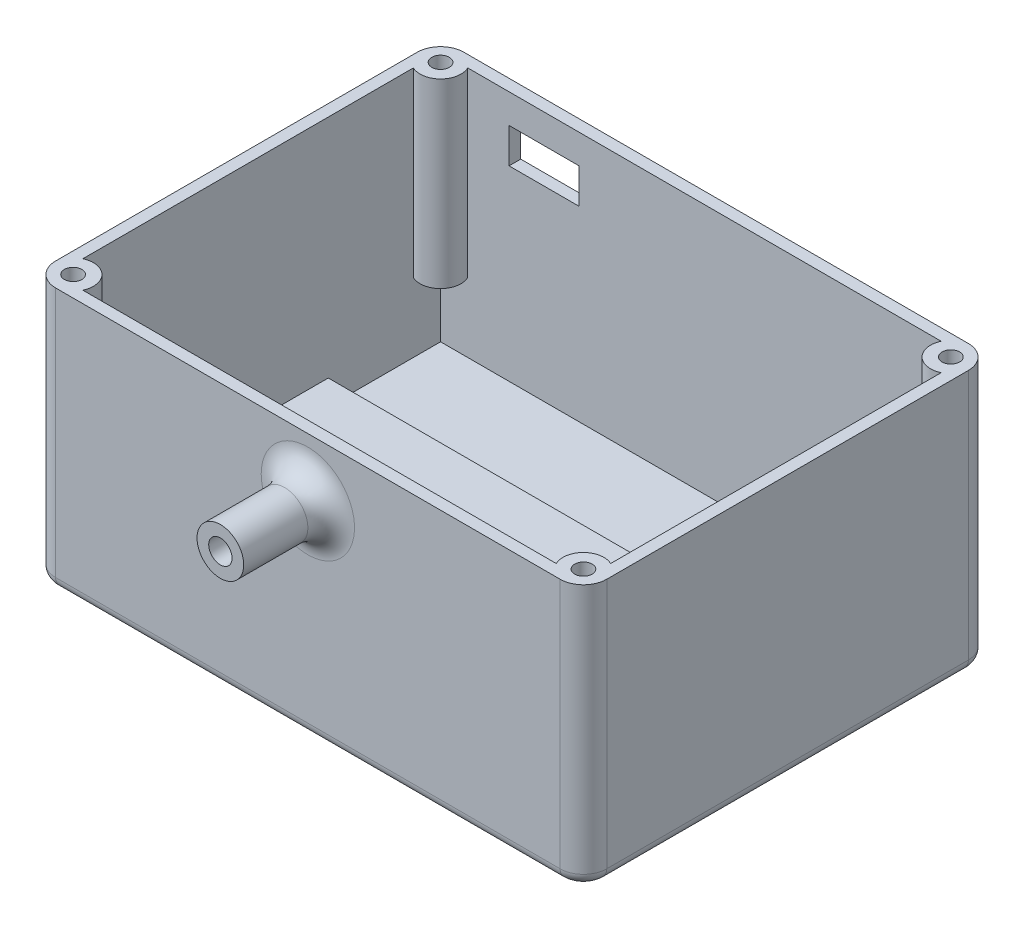
from build123d import *

# Parameters (mm, degrees)
SKETCH1_W                 = 94.5
SKETCH1_H                 = 70
BOSS_EXTRUDE1_DEPTH       = 45
F_3_0MM_DOWEL_HOLE1_D     = 3
F_3_0MM_DOWEL_HOLE1_DEPTH = 30
F_3_0MM_DOWEL_HOLE1_TIP   = 0.901290929
SKETCH7_W                 = 55
SKETCH7_H                 = 28
CUT_EXTRUDE2_DEPTH        = 20
SHELL2_START              = 2
SHELL2_DEPTH              = 43
SHELL2_START_2            = 22
SHELL2_2_OUTLINE_W        = 59
SHELL2_2_OUTLINE_H        = 31
SHELL2_2_DEPTH            = 23
SHELL2_3_DEPTH            = 11.868454444
CUT_EXTRUDE3_DEPTH        = 1.5
BOSS_EXTRUDE9_DEPTH       = 11
F_3_0MM_DOWEL_HOLE3_D     = 3
F_3_0MM_DOWEL_HOLE3_DEPTH = 10
F_3_0MM_DOWEL_HOLE3_TIP   = 0.901290929
SKETCH15_R                = 3.5
CUT_EXTRUDE4_DEPTH        = 3
SKETCH30_W                = 10.076322372
SKETCH30_H                = 8
BOSS_EXTRUDE5_DEPTH       = 20
SKETCH31_W                = 15
SKETCH31_H                = 10.554348819
BOSS_EXTRUDE6_DEPTH       = 20
F_3_0MM_DOWEL_HOLE4_D     = 3
F_3_0MM_DOWEL_HOLE4_DEPTH = 41
F_3_0MM_DOWEL_HOLE4_TIP   = 0.901290929
SKETCH27_W                = 12
SKETCH27_H                = 6
CUT_EXTRUDE5_DEPTH        = 30
SKETCH33_R                = 4
BOSS_EXTRUDE7_DEPTH       = 15
SKETCH34_R                = 2
CUT_EXTRUDE6_DEPTH        = 30
FILLET1_R                 = 4
FILLET2_R                 = 4
FILLET3_R                 = 2


with BuildPart() as part:
    # Sketch1 → Boss-Extrude1 (new body)
    with BuildSketch(Plane(origin=(0, 0, 0), x_dir=(1, 0, 0), z_dir=(0, 1, 0))):
        Rectangle(SKETCH1_W, SKETCH1_H)
    extrude(amount=BOSS_EXTRUDE1_DEPTH)

    # Ø3.0mm Dowel Hole1
    with Locations(Plane(origin=(-43.75, 45, -31.5), x_dir=(0, 0, 1), z_dir=(0, 1, 0))):
        with Locations((0, 0), (0, 87.5), (63, 87.5), (63, 0)):
            Hole(F_3_0MM_DOWEL_HOLE1_D / 2, depth=F_3_0MM_DOWEL_HOLE1_DEPTH)
            with Locations((0, 0, -(F_3_0MM_DOWEL_HOLE1_DEPTH + F_3_0MM_DOWEL_HOLE1_TIP / 2))):  # 118° drill point
                Cone(0, F_3_0MM_DOWEL_HOLE1_D / 2, F_3_0MM_DOWEL_HOLE1_TIP, mode=Mode.SUBTRACT)

    # Sketch7 → Cut-Extrude2 (cut)
    with BuildSketch(Plane.XZ):
        with Locations((0, 18)):
            Rectangle(SKETCH7_W, SKETCH7_H)
    extrude(amount=-CUT_EXTRUDE2_DEPTH, mode=Mode.SUBTRACT)

    # Shell2: read off the stored shape, not the designer's step
    # Shell2 outline → Shell2 (cut)
    with BuildSketch(Plane(origin=(0, 0, 0), x_dir=(1, 0, 0), z_dir=(0, 1, 0)).offset(SHELL2_START)):
        with BuildLine():
            Line((-45.25, 28.33772234), (-45.25, -28.33772234))
            ThreePointArc((-45.25, -28.33772234), (-41.275126266, -29.025126266), (-40.58772234, -33))
            Line((-40.58772234, -33), (-29.5, -33))
            Line((-29.5, -33), (-29.5, -2))
            Line((-29.5, -2), (29.5, -2))
            Line((29.5, -2), (29.5, -33))
            Line((29.5, -33), (40.58772234, -33))
            ThreePointArc((40.58772234, -33), (41.275126266, -29.025126266), (45.25, -28.33772234))
            Line((45.25, -28.33772234), (45.25, 28.33772234))
            ThreePointArc((45.25, 28.33772234), (41.275126266, 29.025126266), (40.58772234, 33))
            Line((40.58772234, 33), (-40.58772234, 33))
            ThreePointArc((-40.58772234, 33), (-41.275126266, 29.025126266), (-45.25, 28.33772234))
        make_face()
    extrude(amount=SHELL2_DEPTH, mode=Mode.SUBTRACT)

    # Shell2 2 outline → Shell2 2 (cut)
    with BuildSketch(Plane(origin=(0, 0, 0), x_dir=(1, 0, 0), z_dir=(0, 1, 0)).offset(SHELL2_START_2)):
        with Locations((0, -17.5)):
            Rectangle(SHELL2_2_OUTLINE_W, SHELL2_2_OUTLINE_H)
    extrude(amount=SHELL2_2_DEPTH, mode=Mode.SUBTRACT)

    # Shell2 3 outline → Shell2 3 (cut)
    with BuildSketch(Plane(origin=(0, 0, 0), x_dir=(1, 0, 0), z_dir=(0, 1, 0)).offset(SHELL2_START)):
        with BuildLine():
            Line((-45.25, -28.33772234), (-45.25, -33))
            Line((-45.25, -33), (-40.58772234, -33))
            ThreePointArc((-40.58772234, -33), (-41.275126266, -29.025126266), (-45.25, -28.33772234))
        make_face()
        with BuildLine():
            Line((-45.25, 33), (-45.25, 28.33772234))
            ThreePointArc((-45.25, 28.33772234), (-41.275126266, 29.025126266), (-40.58772234, 33))
            Line((-40.58772234, 33), (-45.25, 33))
        make_face()
        with BuildLine():
            Line((45.25, 33), (40.58772234, 33))
            ThreePointArc((40.58772234, 33), (41.275126266, 29.025126266), (45.25, 28.33772234))
            Line((45.25, 28.33772234), (45.25, 33))
        make_face()
        with BuildLine():
            ThreePointArc((45.25, -28.33772234), (41.275126266, -29.025126266), (40.58772234, -33))
            Line((40.58772234, -33), (45.25, -33))
            Line((45.25, -33), (45.25, -28.33772234))
        make_face()
    extrude(amount=SHELL2_3_DEPTH, mode=Mode.SUBTRACT)

    # Shell2 4 outline → Shell2 4 (revolve)
    with BuildSketch(Plane(origin=(-43.75, 0, 31.5), x_dir=(1, 0, 0), z_dir=(0, 0, 1))):
        Polygon((0, 13.868454444), (0, 11.765442277), (3.5, 13.868454444), align=None)
    revolve(axis=Axis((-43.75, 0, 31.5), (0, 1, 0)))

    # Shell2 5 outline → Shell2 5 (revolve)
    with BuildSketch(Plane(origin=(43.75, 0, 31.5), x_dir=(1, 0, 0), z_dir=(0, 0, 1))):
        Polygon((0, 13.868454444), (0, 11.765442277), (3.5, 13.868454444), align=None)
    revolve(axis=Axis((43.75, 0, 31.5), (0, 1, 0)))

    # Shell2 6 outline → Shell2 6 (revolve)
    with BuildSketch(Plane(origin=(43.75, 0, -31.5), x_dir=(1, 0, 0), z_dir=(0, 0, 1))):
        Polygon((0, 13.868454444), (0, 11.765442277), (3.5, 13.868454444), align=None)
    revolve(axis=Axis((43.75, 0, -31.5), (0, 1, 0)))

    # Shell2 7 outline → Shell2 7 (revolve)
    with BuildSketch(Plane(origin=(-43.75, 0, -31.5), x_dir=(1, 0, 0), z_dir=(0, 0, 1))):
        Polygon((0, 13.868454444), (0, 11.765442277), (3.5, 13.868454444), align=None)
    revolve(axis=Axis((-43.75, 0, -31.5), (0, 1, 0)))

    # Sketch8 → Cut-Extrude3 (cut)
    with BuildSketch(Plane.XZ):
        with BuildLine():
            Line((27.5, 25), (27.5, 11))
            ThreePointArc((27.5, 11), (34.5, 18), (27.5, 25))
        make_face()
        with BuildLine():
            ThreePointArc((-27.5, 25), (-34.5, 18), (-27.5, 11))
            Line((-27.5, 11), (-27.5, 25))
        make_face()
    extrude(amount=-CUT_EXTRUDE3_DEPTH, mode=Mode.SUBTRACT)

    # Sketch36 → Boss-Extrude9 (add)
    with BuildSketch(Plane.XZ.offset(-1.5)):
        with BuildLine():
            Line((-27.5, 25), (-27.5, 11))
            ThreePointArc((-27.5, 11), (-34.5, 18), (-27.5, 25))
        make_face()
        with BuildLine():
            Line((27.5, 25), (27.5, 11))
            ThreePointArc((27.5, 11), (34.5, 18), (27.5, 25))
        make_face()
    extrude(amount=-BOSS_EXTRUDE9_DEPTH)

    # Ø3.0mm Dowel Hole3
    with Locations(Plane(origin=(31.2, 1.5, 18), x_dir=(0, 0, -1), z_dir=(0, -1, 0))):
        with Locations((0, 0), (0, -62.4)):
            Hole(F_3_0MM_DOWEL_HOLE3_D / 2, depth=F_3_0MM_DOWEL_HOLE3_DEPTH)
            with Locations((0, 0, -(F_3_0MM_DOWEL_HOLE3_DEPTH + F_3_0MM_DOWEL_HOLE3_TIP / 2))):  # 118° drill point
                Cone(0, F_3_0MM_DOWEL_HOLE3_D / 2, F_3_0MM_DOWEL_HOLE3_TIP, mode=Mode.SUBTRACT)

    # Sketch15 → Cut-Extrude4 (cut)
    with BuildSketch(Plane.ZY.offset(-27.5)):
        with Locations(Location((15.383017002, 17, 0), (0, 0, 58.997280866))):
            Circle(SKETCH15_R)
    extrude(amount=-CUT_EXTRUDE4_DEPTH, mode=Mode.SUBTRACT)

    # Sketch30 → Boss-Extrude5 (add)
    with BuildSketch(Plane(origin=(0, 2, 0), x_dir=(1, 0, 0), z_dir=(0, 1, 0))):
        with Locations((34.538161186, -29)):
            Rectangle(SKETCH30_W, SKETCH30_H)
        with Locations((-34.538161186, -29)):
            Rectangle(SKETCH30_W, SKETCH30_H)
    extrude(amount=BOSS_EXTRUDE5_DEPTH)

    # Sketch31 → Boss-Extrude6 (add)
    with BuildSketch(Plane(origin=(0, 2, 0), x_dir=(1, 0, 0), z_dir=(0, 1, 0))):
        with Locations((37.75, 27.722825591)):
            Rectangle(SKETCH31_W, SKETCH31_H)
    extrude(amount=BOSS_EXTRUDE6_DEPTH)

    # Ø3.0mm Dowel Hole4
    with Locations(Plane(origin=(36.25, 45, 28), x_dir=(0, 0, 1), z_dir=(0, 1, 0))):
        with Locations((0, 0), (0.35318171, -72.224429626), (-56, 0)):
            Hole(F_3_0MM_DOWEL_HOLE4_D / 2, depth=F_3_0MM_DOWEL_HOLE4_DEPTH)
            with Locations((0, 0, -(F_3_0MM_DOWEL_HOLE4_DEPTH + F_3_0MM_DOWEL_HOLE4_TIP / 2))):  # 118° drill point
                Cone(0, F_3_0MM_DOWEL_HOLE4_D / 2, F_3_0MM_DOWEL_HOLE4_TIP, mode=Mode.SUBTRACT)

    # Sketch27 → Cut-Extrude5 (cut)
    with BuildSketch(Plane(origin=(0, 0, -35), x_dir=(-1, 0, 0), z_dir=(0, 0, -1))):
        with Locations((27.5, 37)):
            Rectangle(SKETCH27_W, SKETCH27_H)
    extrude(amount=-CUT_EXTRUDE5_DEPTH, mode=Mode.SUBTRACT)

    # Sketch33 → Boss-Extrude7 (add)
    with BuildSketch(Plane.XY.offset(35)):
        with Locations(Location((0, 35, 0), (0, 0, 180))):
            Circle(SKETCH33_R)
    extrude(amount=BOSS_EXTRUDE7_DEPTH)

    # Sketch34 → Cut-Extrude6 (cut)
    with BuildSketch(Plane.XY.offset(50)):
        with Locations((0, 35)):
            Circle(SKETCH34_R)
    extrude(amount=-CUT_EXTRUDE6_DEPTH, mode=Mode.SUBTRACT)

    # Fillet1
    fillet1_edges = [part.edges().sort_by_distance(p)[0] for p in [
        (4, 35, 35),
    ]]
    fillet(fillet1_edges, radius=FILLET1_R)

    # Fillet2
    fillet2_edges = [part.edges().sort_by_distance(p)[0] for p in [
        (47.25, 22.5, 35),
        (-47.25, 22.5, 35),
        (-47.25, 22.5, -35),
        (47.25, 22.5, -35),
    ]]
    fillet(fillet2_edges, radius=FILLET2_R)

    # Fillet3
    fillet3_edges = [part.edges().sort_by_distance(p)[0] for p in [
        (0, 0, 35),
        (47.25, 0, 0),
        (-47.25, 0, 0),
        (0, 0, -35),
        (46.078427125, 0, -33.828427125),
        (46.078427125, 0, 33.828427125),
        (-46.078427125, 0, -33.828427125),
        (-46.078427125, 0, 33.828427125),
    ]]
    fillet(fillet3_edges, radius=FILLET3_R)


solid = part.part
